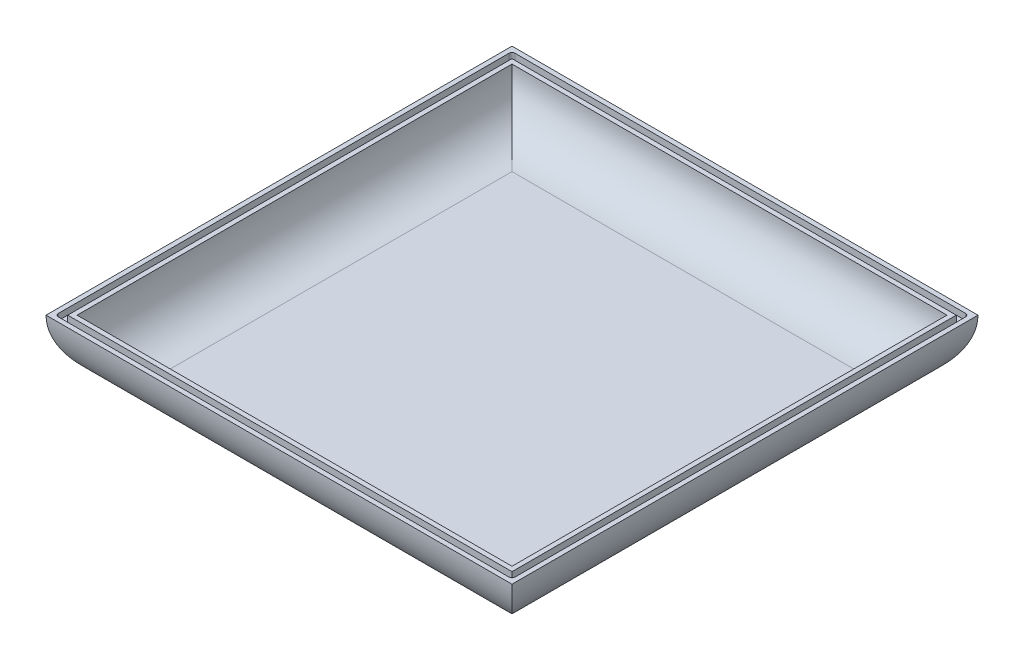
from build123d import *

# Parameters (mm, degrees)
SKETCH1_W           = 150
SKETCH1_H           = 150
BOSS_EXTRUDE1_DEPTH = 20
FILLET8_R           = 20
SHELL1_T            = -5
SKETCH13_W          = 143
SKETCH13_H          = 143
CUT_EXTRUDE5_DEPTH  = 2
SKETCH14_R          = 12
SKETCH14_R_2        = 10
BOSS_EXTRUDE5_DEPTH = 20
RIB18_START         = -2.5
RIB18_DEPTH         = 5
CIRPATTERN1_COUNT   = 4


# Read off the part's stored shape, not the designer's step: Rib18
with BuildPart() as part:
    # Sketch1 → Boss-Extrude1 (new body)
    with BuildSketch(Plane(origin=(0, 0, 0), x_dir=(1, 0, 0), z_dir=(0, 1, 0))):
        with Locations((75, 75)):
            Rectangle(SKETCH1_W, SKETCH1_H)
    extrude(amount=BOSS_EXTRUDE1_DEPTH)

    # Fillet8
    fillet8_edges = [part.edges().sort_by_distance(p)[0] for p in [
        (75, 0, -150),
        (150, 0, -75),
        (75, 0, 0),
        (0, 0, -75),
    ]]
    fillet(fillet8_edges, radius=FILLET8_R - 0.0001)  # a hair under: the kernel refuses the full size

    # Shell1
    shell1_openings = [part.faces().sort_by_distance(p)[0] for p in [
        (75, 20, -75),
    ]]
    offset(amount=SHELL1_T, openings=shell1_openings)

    # Sketch13 → Cut-Extrude5 (cut)
    with BuildSketch(Plane(origin=(0, 20, 0), x_dir=(1, 0, 0), z_dir=(0, 1, 0))):
        with BuildLine():
            Line((1.5, 147.5), (1.5, 2.5))
            ThreePointArc((1.5, 2.5), (1.792893219, 1.792893219), (2.5, 1.5))
            Line((2.5, 1.5), (147.5, 1.5))
            ThreePointArc((147.5, 1.5), (148.207106781, 1.792893219), (148.5, 2.5))
            Line((148.5, 2.5), (148.5, 147.5))
            ThreePointArc((148.5, 147.5), (148.207106781, 148.207106781), (147.5, 148.5))
            Line((147.5, 148.5), (2.5, 148.5))
            ThreePointArc((2.5, 148.5), (1.792893219, 148.207106781), (1.5, 147.5))
        make_face()
        with Locations((75, 75)):
            Rectangle(SKETCH13_W, SKETCH13_H, mode=Mode.SUBTRACT)
    extrude(amount=-CUT_EXTRUDE5_DEPTH, mode=Mode.SUBTRACT)

    # Sketch14 → Boss-Extrude5 (add)
    with BuildSketch(Plane.XZ):
        with Locations(Location((75, -75, 0), (0, 0, 270))):
            Circle(SKETCH14_R)
        with Locations(Location((75, -75, 0), (0, 0, 270))):
            Circle(SKETCH14_R_2, mode=Mode.SUBTRACT)
    extrude(amount=BOSS_EXTRUDE5_DEPTH)

    # Rib18 outline → Rib18 (add)
    with BuildSketch(Plane.ZY.offset(-75).offset(RIB18_START)):
        Polygon((-85, 0), (-116.088549687, 0), (-86.736694594, -15.785154629), (-85, -16.719132826), align=None)
    rib18 = extrude(amount=RIB18_DEPTH)

    # CirPattern1: Rib18 ×4 about axis
    cirpattern1_axis = Axis((75, 0, -75), (0, 1, 0))
    for i in range(1, CIRPATTERN1_COUNT):
        add(rib18.rotate(cirpattern1_axis, i * 360 / CIRPATTERN1_COUNT))


solid = part.part
